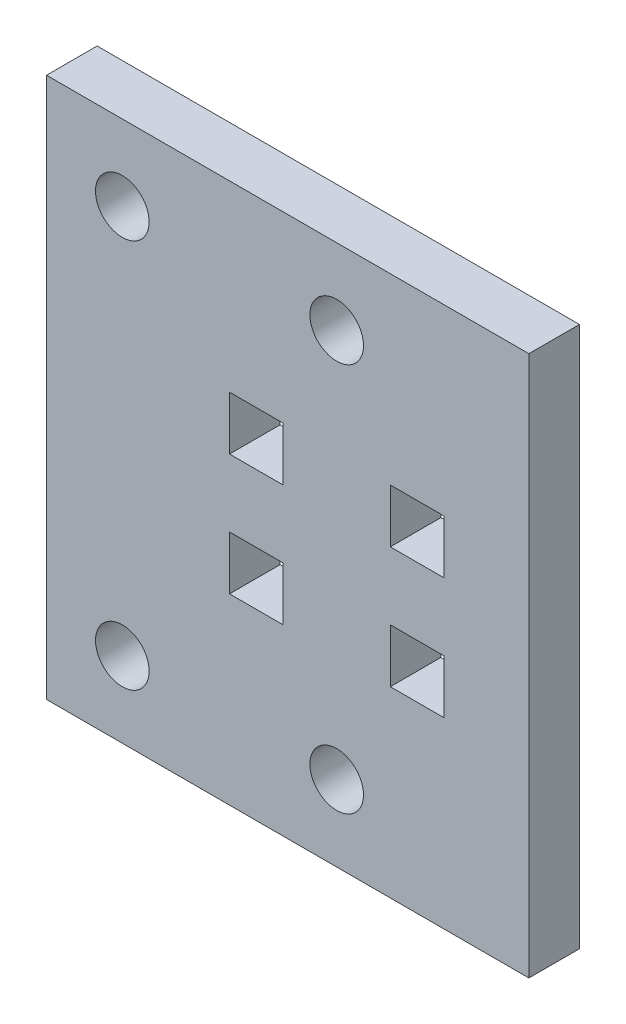
from build123d import *

# Parameters (mm, degrees)
SKETCH1_W           = 57.15
SKETCH1_H           = 64.060512242
SKETCH1_R           = 3.175
SKETCH1_W_2         = 6.35
SKETCH1_H_2         = 6.35
BOSS_EXTRUDE1_DEPTH = 5.9944


with BuildPart() as part:
    # Sketch1 → Boss-Extrude1 (new body)
    with BuildSketch(Plane(origin=(0, 0, 0), x_dir=(-1, 0, 0), z_dir=(0, 0, 1))):
        with Locations((33.534836058, -1.33105998)):
            Rectangle(SKETCH1_W, SKETCH1_H)
        with Locations((53.129579937, -24.38105998)):
            Circle(SKETCH1_R, mode=Mode.SUBTRACT)
        with Locations((53.129579937, 21.71894002)):
            Circle(SKETCH1_R, mode=Mode.SUBTRACT)
        with Locations((27.729579937, -24.38105998)):
            Circle(SKETCH1_R, mode=Mode.SUBTRACT)
        with Locations((27.729579937, 21.71894002)):
            Circle(SKETCH1_R, mode=Mode.SUBTRACT)
        with Locations((18.204579937, 5.84394002)):
            Rectangle(SKETCH1_W_2, SKETCH1_H_2, mode=Mode.SUBTRACT)
        with Locations((37.254579937, -8.50605998)):
            Rectangle(SKETCH1_W_2, SKETCH1_H_2, mode=Mode.SUBTRACT)
        with Locations((18.204579937, -8.50605998)):
            Rectangle(SKETCH1_W_2, SKETCH1_H_2, mode=Mode.SUBTRACT)
        with Locations((37.254579937, 5.84394002)):
            Rectangle(SKETCH1_W_2, SKETCH1_H_2, mode=Mode.SUBTRACT)
    extrude(amount=BOSS_EXTRUDE1_DEPTH)


solid = part.part
